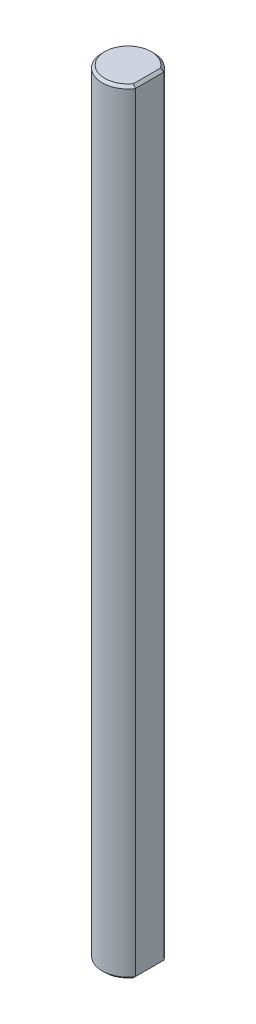
from build123d import *

# Parameters (mm, degrees)
BOSS_EXTRUDE1_DEPTH = 90
CHAMFER1_SIZE       = 0.3


with BuildPart() as part:
    # Sketch1 → Boss-Extrude1 (new body)
    with BuildSketch(Plane(origin=(0, 0, 0), x_dir=(1, 0, 0), z_dir=(0, 1, 0))):
        with BuildLine():
            Line((2.5, 1.658312395), (2.5, -1.658312395))
            ThreePointArc((2.5, -1.658312395), (-3, 0), (2.5, 1.658312395))
        make_face()
    extrude(amount=BOSS_EXTRUDE1_DEPTH)

    # Chamfer1
    chamfer1_edges = [part.edges().sort_by_distance(p)[0] for p in [
        (2.5, 0, 0),
        (-3, 0, 0),
        (2.5, 90, 0),
        (-3, 90, 0),
    ]]
    chamfer(chamfer1_edges, length=CHAMFER1_SIZE)


solid = part.part
